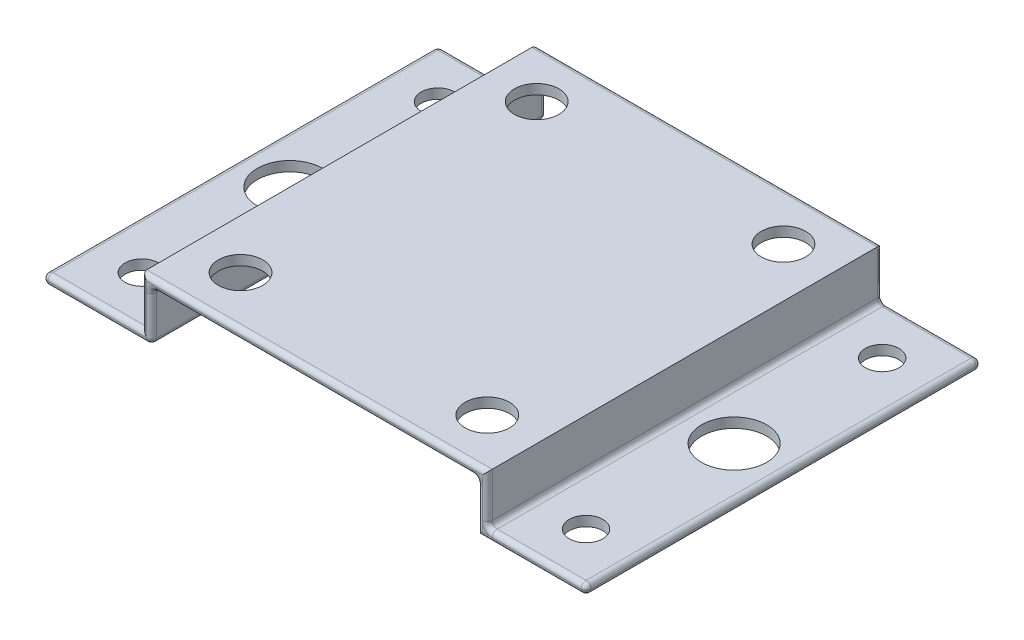
from build123d import *

# Parameters (mm, degrees)
BOSS_EXTRUDE1_DEPTH  = 20
FILLET1_R            = 0.5
M6_CLEARANCE_HOLE1_D = 6.6
M4_CLEARANCE_HOLE1_D = 4.5
M3_CLEARANCE_HOLE1_D = 3.4
MIRROR2_COPY_1_D     = 4.5
MIRROR2_COPY_2_D     = 3.4


with BuildPart() as part:
    # Sketch1 → Boss-Extrude1 (new, symmetric)
    with BuildSketch(Plane.XY):
        Polygon((-17.5, 0), (17.5, 0), (17.5, -5), (27.5, -5), (27.5, -6), (16.5, -6), (16.5, -1), (-16.5, -1), (-16.5, -6), (-27.5, -6), (-27.5, -5), (-17.5, -5), align=None)
    extrude(amount=BOSS_EXTRUDE1_DEPTH, both=True)

    # Fillet1
    fillet1_edges = [part.edges().sort_by_distance(p)[0] for p in [
        (27.5, -5.5, -20),
        (22, -6, -20),
        (0, 0, 20),
        (16.5, -3.5, -20),
        (0, -1, -20),
        (-16.5, -3.5, -20),
        (-22, -6, -20),
        (-27.5, -5.5, -20),
        (-22.5, -5, -20),
        (-17.5, -2.5, -20),
        (0, 0, -20),
        (17.5, -2.5, -20),
        (22.5, -5, -20),
        (-17.5, -2.5, 20),
        (27.5, -5, 0),
        (27.5, -6, 0),
        (-22.5, -5, 20),
        (16.5, -1, 0),
        (-16.5, -1, 0),
        (-16.5, -6, 0),
        (-27.5, -6, 0),
        (-27.5, -5, 0),
        (17.5, -5, 0),
        (-27.5, -5.5, 20),
        (-22, -6, 20),
        (-16.5, -3.5, 20),
        (0, -1, 20),
        (16.5, -3.5, 20),
        (22, -6, 20),
        (27.5, -5.5, 20),
        (22.5, -5, 20),
        (17.5, -2.5, 20),
    ]]
    fillet(fillet1_edges, radius=FILLET1_R - 0.0001)  # a hair under: the kernel refuses the full size

    # M6 Clearance Hole1 (through all)
    with Locations(Plane(origin=(0, -5, 0), x_dir=(1, 0, 0), z_dir=(0, 1, 0))):
        with Locations((-22.5, 0), (22.5, 0)):
            Hole(M6_CLEARANCE_HOLE1_D / 2)

    # M4 Clearance Hole1 (through all)
    with Locations(Plane(origin=(0, 0, 0), x_dir=(1, 0, 0), z_dir=(0, 1, 0))):
        with Locations((-12.5, 15)):
            m4_clearance_hole1 = Hole(M4_CLEARANCE_HOLE1_D / 2)

    # M3 Clearance Hole1 (through all)
    with Locations(Plane(origin=(0, -5, 0), x_dir=(1, 0, 0), z_dir=(0, 1, 0))):
        with Locations((-22.5, 15)):
            m3_clearance_hole1 = Hole(M3_CLEARANCE_HOLE1_D / 2)

    # Mirror1: M4 Clearance Hole1, M3 Clearance Hole1 across plane
    add(m4_clearance_hole1.mirror(Plane(origin=(0, 0, 0), x_dir=(0, 0, 1), z_dir=(1, 0, 0))), mode=Mode.SUBTRACT)
    add(m3_clearance_hole1.mirror(Plane(origin=(0, 0, 0), x_dir=(0, 0, 1), z_dir=(1, 0, 0))), mode=Mode.SUBTRACT)

    # Mirror2: M4 Clearance Hole1, M3 Clearance Hole1 across plane
    add(m4_clearance_hole1.mirror(Plane.XY), mode=Mode.SUBTRACT)
    add(m3_clearance_hole1.mirror(Plane.XY), mode=Mode.SUBTRACT)

    # Mirror2 copy 1 (through all)
    with Locations(Plane(origin=(0, 0, 0), x_dir=(-1, 0, 0), z_dir=(0, 1, 0))):
        with Locations((-12.5, 15)):
            Hole(MIRROR2_COPY_1_D / 2)

    # Mirror2 copy 2 (through all)
    with Locations(Plane(origin=(0, -5, 0), x_dir=(-1, 0, 0), z_dir=(0, 1, 0))):
        with Locations((-22.5, 15)):
            Hole(MIRROR2_COPY_2_D / 2)


solid = part.part
